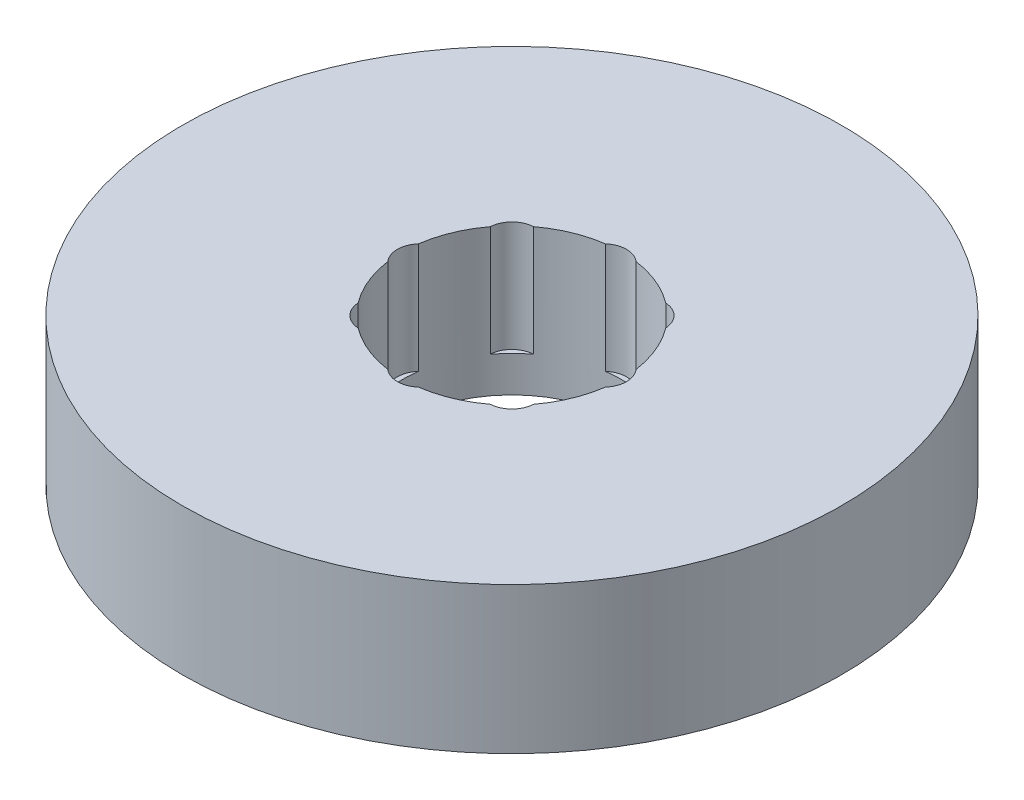
from build123d import *

# Parameters (mm, degrees)
SKETCH1_R           = 22.5
BOSS_EXTRUDE1_DEPTH = 10
SKETCH2_R           = 7.5
CUT_EXTRUDE1_DEPTH  = 34.35416016
SKETCH3_R           = 1.578036786
CUT_EXTRUDE2_DEPTH  = 7.540717935
CIRPATTERN1_COUNT   = 8


with BuildPart() as part:
    # Sketch1 → Boss-Extrude1 (new body)
    with BuildSketch(Plane(origin=(0, 0, 0), x_dir=(1, 0, 0), z_dir=(0, 1, 0))):
        Circle(SKETCH1_R)
    extrude(amount=BOSS_EXTRUDE1_DEPTH)

    # Sketch2 → Cut-Extrude1 (cut, through all)
    with BuildSketch(Plane(origin=(0, 0, 0), x_dir=(1, 0, 0), z_dir=(0, 1, 0))):
        Circle(SKETCH2_R)
    extrude(amount=CUT_EXTRUDE1_DEPTH, mode=Mode.SUBTRACT)

    # Sketch3 → Cut-Extrude2 (cut)
    with BuildSketch(Plane(origin=(0, 10, 0), x_dir=(1, 0, 0), z_dir=(0, 1, 0))):
        with Locations((-6.245323663, 0)):
            Circle(SKETCH3_R)
    cut_extrude2 = extrude(amount=-CUT_EXTRUDE2_DEPTH, mode=Mode.SUBTRACT)

    # CirPattern1: Cut-Extrude2 ×8 about axis
    cirpattern1_axis = Axis((0, 0, 0), (0, 1, 0))
    for i in range(1, CIRPATTERN1_COUNT):
        add(cut_extrude2.rotate(cirpattern1_axis, i * 360 / CIRPATTERN1_COUNT), mode=Mode.SUBTRACT)


solid = part.part
